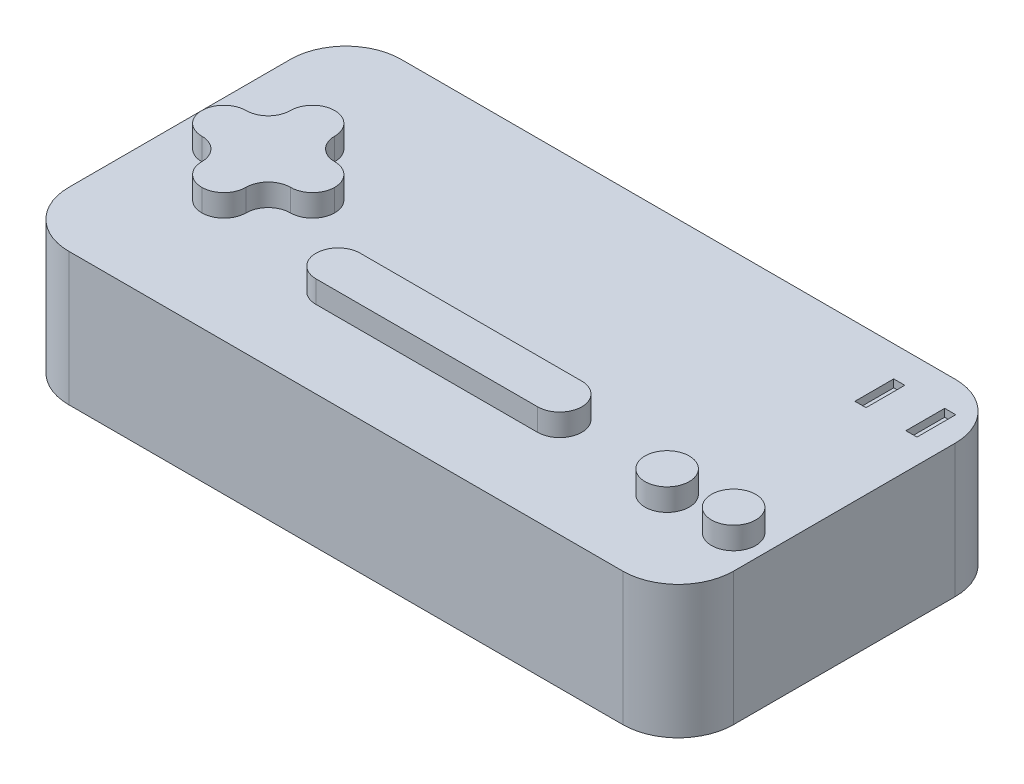
from build123d import *

# Parameters (mm, degrees)
BOSS_EXTRUDE1_DEPTH = 12
SKETCH2_R           = 2
BOSS_EXTRUDE2_DEPTH = 2
SKETCH3_W           = 1
SKETCH3_H           = 3.5
CUT_EXTRUDE1_DEPTH  = 0.7
FILLET2_R           = 2


with BuildPart() as part:
    # Sketch1 → Boss-Extrude1 (new body)
    with BuildSketch(Plane(origin=(0, 0, 0), x_dir=(1, 0, 0), z_dir=(0, 1, 0))):
        with BuildLine():
            Line((5, 0), (55, 0))
            ThreePointArc((55, 0), (58.535533906, 1.464466094), (60, 5))
            Line((60, 5), (60, 25))
            ThreePointArc((60, 25), (58.535533906, 28.535533906), (55, 30))
            Line((55, 30), (5, 30))
            ThreePointArc((5, 30), (1.464466094, 28.535533906), (0, 25))
            Line((0, 25), (0, 5))
            ThreePointArc((0, 5), (1.464466094, 1.464466094), (5, 0))
        make_face()
    extrude(amount=BOSS_EXTRUDE1_DEPTH)

    # Sketch2 → Boss-Extrude2 (add)
    with BuildSketch(Plane(origin=(0, 12, 0), x_dir=(1, 0, 0), z_dir=(0, 1, 0))):
        with Locations(Location((57, 8, 0), (0, 0, 90))):
            Circle(SKETCH2_R)
        with Locations(Location((51, 8, 0), (0, 0, 90))):
            Circle(SKETCH2_R)
        Polygon((2, 17), (2, 13), (6, 13), (6, 9), (10, 9), (10, 13), (14, 13), (14, 17), (10, 17), (10, 21), (6, 21), (6, 17), align=None)
        with BuildLine():
            Line((20.303338261, 11), (40.303338261, 11))
            ThreePointArc((40.303338261, 11), (42.303338261, 9), (40.303338261, 7))
            Line((40.303338261, 7), (20.303338261, 7))
            ThreePointArc((20.303338261, 7), (18.303338261, 9), (20.303338261, 11))
        make_face()
    extrude(amount=BOSS_EXTRUDE2_DEPTH)

    # Sketch3 → Cut-Extrude1 (cut)
    with BuildSketch(Plane(origin=(0, 12, 0), x_dir=(1, 0, 0), z_dir=(0, 1, 0))):
        with Locations((52.7, 25.5)):
            Rectangle(SKETCH3_W, SKETCH3_H)
        with Locations((57.3, 25.5)):
            Rectangle(SKETCH3_W, SKETCH3_H)
    extrude(amount=-CUT_EXTRUDE1_DEPTH, mode=Mode.SUBTRACT)

    # Fillet2
    fillet2_edges = [part.edges().sort_by_distance(p)[0] for p in [
        (6, 13, -9),
        (6, 13, -13),
        (2, 13, -13),
        (2, 13, -17),
        (6, 13, -17),
        (6, 13, -21),
        (10, 13, -21),
        (10, 13, -17),
        (14, 13, -17),
        (14, 13, -13),
        (10, 13, -13),
        (10, 13, -9),
    ]]
    fillet(fillet2_edges, radius=FILLET2_R - 0.0001)  # a hair under: the kernel refuses the full size


solid = part.part
